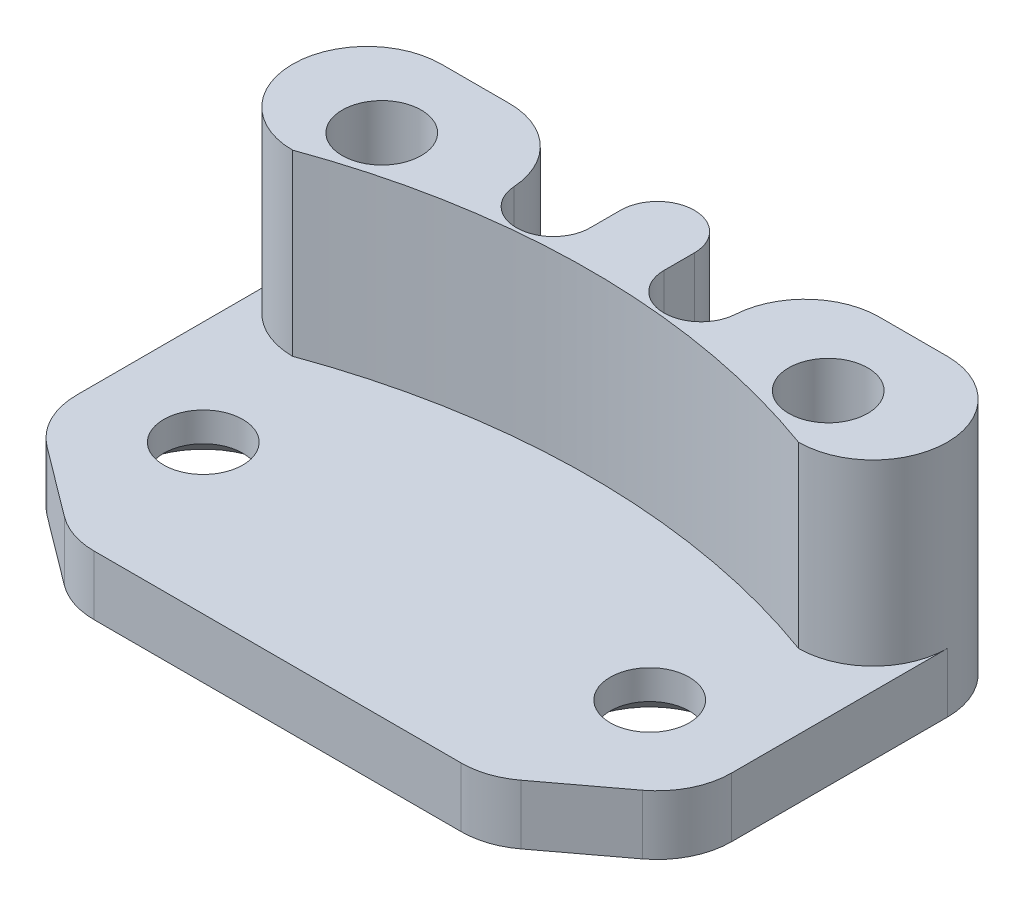
from build123d import *

# Parameters (mm, degrees)
BOSS_EXTRUDE1_DEPTH                                 = 25.4
FILLET1_R                                           = 3.937
FILLET2_R                                           = 7.9375
F_5_16_CLEARANCE_HOLE1_D                            = 8.4328
CSK_FOR_5_16_FLAT_HEAD_MACHINE_SCREW_10_D           = 8.4328
CSK_FOR_5_16_FLAT_HEAD_MACHINE_SCREW_10_CSINK_D     = 16.129
CSK_FOR_5_16_FLAT_HEAD_MACHINE_SCREW_10_CSINK_ANGLE = 100
CUT_EXTRUDE2_DEPTH                                  = 19.05


with BuildPart() as part:
    # Sketch2 → Boss-Extrude1 (new body)
    with BuildSketch(Plane(origin=(0, 0, 0), x_dir=(1, 0, 0), z_dir=(0, 1, 0))):
        Polygon((-11.811, 17.4625), (-3.937, 17.4625), (-3.937, 28.575), (3.937, 28.575), (3.937, 17.4625), (11.811, 17.4625), (11.811, 28.575), (34.925, 28.575), (34.925, -6.35), (22.225, -15.875), (-22.225, -15.875), (-34.925, -6.35), (-34.925, 28.575), (-11.811, 28.575), align=None)
    extrude(amount=BOSS_EXTRUDE1_DEPTH)

    # Fillet1
    fillet1_edges = [part.edges().sort_by_distance(p)[0] for p in [
        (11.811, 12.7, -17.4625),
        (3.937, 12.7, -17.4625),
        (3.937, 12.7, -28.575),
        (-3.937, 12.7, -28.575),
        (-3.937, 12.7, -17.4625),
        (-11.811, 12.7, -17.4625),
    ]]
    fillet(fillet1_edges, radius=FILLET1_R - 0.0001)  # a hair under: the kernel refuses the full size

    # Fillet2
    fillet2_edges = [part.edges().sort_by_distance(p)[0] for p in [
        (34.925, 12.7, 6.35),
        (22.225, 12.7, 15.875),
        (-22.225, 12.7, 15.875),
        (-34.925, 12.7, 6.35),
        (34.925, 12.7, -28.575),
        (11.811, 12.7, -28.575),
        (-11.811, 12.7, -28.575),
        (-34.925, 12.7, -28.575),
    ]]
    fillet(fillet2_edges, radius=FILLET2_R)

    # 5/16 Clearance Hole1 (through all)
    with Locations(Plane(origin=(0, 25.4, 0), x_dir=(1, 0, 0), z_dir=(0, 1, 0))):
        with Locations((-23.8252, 19.05), (23.7998, 19.05)):
            Hole(F_5_16_CLEARANCE_HOLE1_D / 2)

    # CSK for 5/16 Flat Head Machine Screw (100)1 (through all)
    with Locations(Plane(origin=(0, 0, 0), x_dir=(-1, 0, 0), z_dir=(0, -1, 0))):
        with Locations((-23.8125, 0), (23.8125, 0)):
            CounterSinkHole(CSK_FOR_5_16_FLAT_HEAD_MACHINE_SCREW_10_D / 2, CSK_FOR_5_16_FLAT_HEAD_MACHINE_SCREW_10_CSINK_D / 2, counter_sink_angle=CSK_FOR_5_16_FLAT_HEAD_MACHINE_SCREW_10_CSINK_ANGLE)

    # Sketch8 → Cut-Extrude2 (cut)
    with BuildSketch(Plane(origin=(0, 25.4, 0), x_dir=(1, 0, 0), z_dir=(0, 1, 0))):
        with BuildLine():
            Line((24.341666667, -14.2875), (31.75, -8.73125))
            ThreePointArc((31.75, -8.73125), (34.087015829, -5.931007914), (34.925, -2.38125))
            Line((34.925, -2.38125), (34.925, 20.6375))
            ThreePointArc((34.925, 20.6375), (32.600160076, 15.024839924), (26.9875, 12.7))
            ThreePointArc((26.9875, 12.7), (0, 17.4625), (-26.9875, 12.7))
            ThreePointArc((-26.9875, 12.7), (-32.600160076, 15.024839924), (-34.925, 20.6375))
            Line((-34.925, 20.6375), (-34.925, -2.38125))
            ThreePointArc((-34.925, -2.38125), (-34.087015829, -5.931007914), (-31.75, -8.73125))
            Line((-31.75, -8.73125), (-24.341666667, -14.2875))
            ThreePointArc((-24.341666667, -14.2875), (-22.089224559, -15.467673678), (-19.579166667, -15.875))
            Line((-19.579166667, -15.875), (19.579166667, -15.875))
            ThreePointArc((19.579166667, -15.875), (22.089224559, -15.467673678), (24.341666667, -14.2875))
        make_face()
    extrude(amount=-CUT_EXTRUDE2_DEPTH, mode=Mode.SUBTRACT)


solid = part.part
